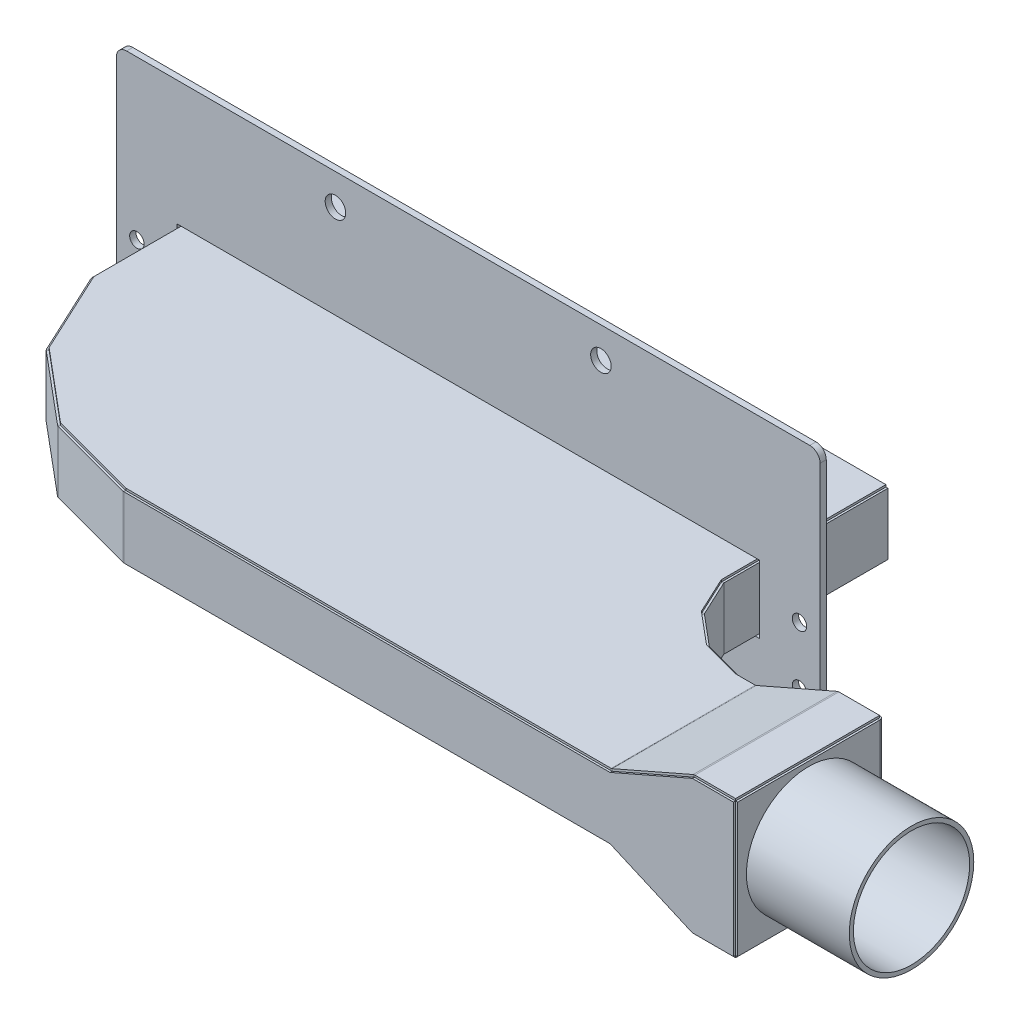
from build123d import *
from build123d.topology import SkipClean

# Parameters (mm, degrees)
BOSS_EXTRUDE1_DEPTH               = 15
BOSS_EXTRUDE2_DEPTH               = 70
CONVERT_SOLID1_START              = -15
CONVERT_SOLID1_DEPTH              = 30
CONVERT_SOLID1_START_2            = 126.158288837
CONVERT_SOLID1_2_DEPTH            = 1
CONVERT_SOLID2_START              = -15
CONVERT_SOLID2_DEPTH              = 30
CONVERT_SOLID2_START_2            = 55.181583873
CONVERT_SOLID2_2_DEPTH            = 1.976704964
CONVERT_SOLID2_START_3            = 56.997604841
CONVERT_SOLID2_3_OUTLINE_W        = 1
CONVERT_SOLID2_3_OUTLINE_H        = 17.5
CONVERT_SOLID2_3_DEPTH            = 69.160683996
CONVERT_SOLID2_START_4            = 55.158288837
CONVERT_SOLID2_4_DEPTH            = 1
CONVERT_SOLID2_START_5            = -33
CONVERT_SOLID2_5_DEPTH            = 66
CONVERT_SOLID3_OUTLINE_W          = 280
CONVERT_SOLID3_OUTLINE_H          = 1
CONVERT_SOLID3_DEPTH              = 44.929534518
CONVERT_SOLID3_START              = 56.158288837
CONVERT_SOLID3_2_DEPTH            = 70
CONVERT_SOLID3_START_2            = 15
CONVERT_SOLID3_3_DEPTH            = 1
CONVERT_SOLID4_OUTLINE_W          = 280
CONVERT_SOLID4_OUTLINE_H          = 1
CONVERT_SOLID4_DEPTH              = 44.929534518
CONVERT_SOLID4_START              = 56.158288837
CONVERT_SOLID4_2_DEPTH            = 70
CONVERT_SOLID4_START_2            = -16
CONVERT_SOLID4_3_DEPTH            = 1
SKETCH13_R                        = 29.5
CUT_EXTRUDE1_DEPTH                = 30
SKETCH14_W                        = 342
SKETCH14_H                        = 76
SKETCH14_W_2                      = 283
SKETCH14_H_2                      = 33
BOSS_EXTRUDE3_DEPTH               = 3
SKETCH16_W                        = 3.5
SKETCH16_H                        = 127.158288837
F_7_0_7_DIAMETER_HOLE2_AT_2_COUNT = 2
F_7_0_7_DIAMETER_HOLE2_AT_2_PITCH = 80.5
F_7_0_7_DIAMETER_HOLE2_AT_3_COUNT = 2
F_7_0_7_DIAMETER_HOLE2_AT_3_PITCH = 80.5
MIRROR1_OUTLINE_R                 = 3.5
MIRROR1_DEPTH                     = 3
SKETCH19_W                        = 3.5
SKETCH19_H                        = 127.158288837
SKETCH20_W                        = 342
SKETCH20_H                        = 39
BOSS_EXTRUDE4_DEPTH               = 3
SKETCH21_W                        = 1
SKETCH21_H                        = 30
BOSS_EXTRUDE5_DEPTH               = 60
SKETCH21_4_W                      = 280
SKETCH21_4_H                      = 1
BOSS_EXTRUDE6_DEPTH               = 60
SKETCH21_5_W                      = 280
SKETCH21_5_H                      = 1
BOSS_EXTRUDE7_DEPTH               = 60
SKETCH21_6_W                      = 1
SKETCH21_6_H                      = 30
BOSS_EXTRUDE8_DEPTH               = 60
SKETCH23_W                        = 5
SKETCH23_H                        = 63
M8_CLEARANCE_HOLE1_AT_2_COUNT     = 2
M8_CLEARANCE_HOLE1_AT_2_PITCH     = 129
SKETCH24_R                        = 30.25
SKETCH24_R_2                      = 28.25
BOSS_EXTRUDE9_DEPTH               = 50
FILLET1_R                         = 5


with BuildPart() as part:
    # Sketch1 → Boss-Extrude1 (new, symmetric)
    with BuildSketch(Plane(origin=(0, 0, 0), x_dir=(1, 0, 0), z_dir=(0, 1, 0))):
        Polygon((-140, 0), (-140, -44.929534518), (-121.011958221, -85.649521519), (-86.593937972, -114.529669616), (-43.195340218, -126.158288837), (193.091770623, -126.158288837), (193.091770623, -56.158288837), (183.091770623, -56.158288837), (163.773254097, -50.981907934), (148.452365235, -38.126155741), (140, -20), (140, 0), align=None)
    extrude(amount=BOSS_EXTRUDE1_DEPTH, both=True)

    # Sketch2 → Boss-Extrude2 (add)
    with BuildSketch(Plane.XY.offset(126.158288837)):
        Polygon((193.091770623, 15), (233.091770623, 32.5), (253.091770623, 32.5), (253.091770623, -32.5), (233.091770623, -32.5), (193.091770623, -15), align=None)
    extrude(amount=-BOSS_EXTRUDE2_DEPTH)


with BuildPart() as body_2:
    # Convert-Solid1: read off the stored shape, not the designer's step
    # Convert-Solid1 outline → Convert-Solid1 (new body)
    with BuildSketch(Plane(origin=(0, 0, 0), x_dir=(1, 0, 0), z_dir=(0, 1, 0)).offset(CONVERT_SOLID1_START)):
        with BuildLine():
            Line((253.091770623, -127.158288837), (253.091770623, -126.158288837))
            Line((253.091770623, -126.158288837), (-43.063687721, -126.158288837))
            ThreePointArc((-43.063687721, -126.158288837), (-43.194213913, -126.149733698), (-43.322506766, -126.124214663))
            Line((-43.322506766, -126.124214663), (-86.379797372, -114.587048417))
            ThreePointArc((-86.379797372, -114.587048417), (-86.582726941, -114.508133424), (-86.763765937, -114.387167033))
            Line((-86.763765937, -114.387167033), (-120.842130257, -85.792024101))
            ThreePointArc((-120.842130257, -85.792024101), (-120.992695988, -85.634741087), (-121.105650434, -85.44859792))
            Line((-121.105650434, -85.44859792), (-139.906307787, -45.130458117))
            ThreePointArc((-139.906307787, -45.130458117), (-139.976296007, -44.924279469), (-140, -44.707839855))
            Line((-140, -44.707839855), (-140, 0))
            Line((-140, 0), (-141, 0))
            Line((-141, 0), (-141, -44.707839855))
            ThreePointArc((-141, -44.707839855), (-140.952592014, -45.140719083), (-140.812615574, -45.553076378))
            Line((-140.812615574, -45.553076378), (-122.011958221, -85.871216182))
            ThreePointArc((-122.011958221, -85.871216182), (-121.786049328, -86.243502516), (-121.484917867, -86.558068544))
            Line((-121.484917867, -86.558068544), (-87.406553546, -115.153211477))
            ThreePointArc((-87.406553546, -115.153211477), (-87.044475553, -115.395144257), (-86.638616417, -115.552974243))
            Line((-86.638616417, -115.552974243), (-43.581325811, -127.090140489))
            ThreePointArc((-43.581325811, -127.090140489), (-43.324740105, -127.141178559), (-43.063687721, -127.158288837))
            Line((-43.063687721, -127.158288837), (253.091770623, -127.158288837))
        make_face()
    extrude(amount=CONVERT_SOLID1_DEPTH)

    # Convert-Solid1 2 outline → Convert-Solid1 2 (add)
    with BuildSketch(Plane.XY.offset(CONVERT_SOLID1_START_2)):
        Polygon((193.091770623, 15), (253.091770623, 15), (253.091770623, 32.5), (233.091770623, 32.5), align=None)
        Polygon((193.091770623, -15), (233.091770623, -32.5), (253.091770623, -32.5), (253.091770623, -15), align=None)
    extrude(amount=CONVERT_SOLID1_2_DEPTH)

    # Sketch21<6> → Boss-Extrude8 (add)
    with BuildSketch(Plane(origin=(0, 0, 0), x_dir=(-1, 0, 0), z_dir=(0, 0, -1))):
        with Locations((140.5, 0)):
            Rectangle(SKETCH21_6_W, SKETCH21_6_H)
    extrude(amount=BOSS_EXTRUDE8_DEPTH)


with BuildPart() as body_3:
    # Convert-Solid2: read off the stored shape, not the designer's step
    # Convert-Solid2 outline → Convert-Solid2 (new body)
    with BuildSketch(Plane(origin=(0, 0, 0), x_dir=(1, 0, 0), z_dir=(0, 1, 0)).offset(CONVERT_SOLID2_START)):
        with BuildLine():
            Line((141, -19.556610675), (141, 0))
            Line((141, 0), (140, 0))
            Line((140, 0), (140, -19.556610675))
            ThreePointArc((140, -19.556610675), (140.047407986, -19.989489903), (140.187384426, -20.401847198))
            Line((140.187384426, -20.401847198), (148.264980809, -37.724308543))
            ThreePointArc((148.264980809, -37.724308543), (148.490889702, -38.096594877), (148.792021164, -38.411160905))
            Line((148.792021164, -38.411160905), (163.433598168, -50.69690277))
            ThreePointArc((163.433598168, -50.69690277), (163.795676161, -50.93883555), (164.201535298, -51.096665536))
            Line((164.201535298, -51.096665536), (182.837437528, -56.090140489))
            ThreePointArc((182.837437528, -56.090140489), (183.094023234, -56.141178559), (183.355075618, -56.158288837))
            Line((183.355075618, -56.158288837), (252.091770623, -56.158288837))
            ThreePointArc((252.091770623, -56.158288837), (252.798877404, -56.451182055), (253.091770623, -57.158288837))
            Line((253.091770623, -57.158288837), (253.091770623, -126.158288837))
            Line((253.091770623, -126.158288837), (254.091770623, -126.158288837))
            Line((254.091770623, -126.158288837), (254.091770623, -57.158288837))
            ThreePointArc((254.091770623, -57.158288837), (253.505984185, -55.744075275), (252.091770623, -55.158288837))
            Line((252.091770623, -55.158288837), (183.355075618, -55.158288837))
            ThreePointArc((183.355075618, -55.158288837), (183.224549426, -55.149733698), (183.096256573, -55.124214663))
            Line((183.096256573, -55.124214663), (164.460354343, -50.13073971))
            ThreePointArc((164.460354343, -50.13073971), (164.257424775, -50.051824717), (164.076385778, -49.930858327))
            Line((164.076385778, -49.930858327), (149.434808773, -37.645116462))
            ThreePointArc((149.434808773, -37.645116462), (149.284243043, -37.487833448), (149.171288596, -37.301690281))
            Line((149.171288596, -37.301690281), (141.093692213, -19.979228936))
            ThreePointArc((141.093692213, -19.979228936), (141.023703993, -19.773050289), (141, -19.556610675))
        make_face()
    extrude(amount=CONVERT_SOLID2_DEPTH)

    # Convert-Solid2 2 outline → Convert-Solid2 2 (add)
    with BuildSketch(Plane.XY.offset(CONVERT_SOLID2_START_2)):
        Polygon((233.091770623, -32.5), (254.091770623, -32.5), (254.091770623, -15), (193.091770623, -15), align=None)
        Polygon((193.091770623, 15), (254.091770623, 15), (254.091770623, 32.5), (233.091770623, 32.5), align=None)
    extrude(amount=CONVERT_SOLID2_2_DEPTH)

    # Convert-Solid2 3 outline → Convert-Solid2 3 (add)
    with BuildSketch(Plane.XY.offset(CONVERT_SOLID2_START_3)):
        with Locations((253.591770623, -23.75)):
            Rectangle(CONVERT_SOLID2_3_OUTLINE_W, CONVERT_SOLID2_3_OUTLINE_H)
        with Locations((253.591770623, 23.75)):
            Rectangle(CONVERT_SOLID2_3_OUTLINE_W, CONVERT_SOLID2_3_OUTLINE_H)
    extrude(amount=CONVERT_SOLID2_3_DEPTH)

    # Convert-Solid2 4 outline → Convert-Solid2 4 (add)
    with BuildSketch(Plane.XY.offset(CONVERT_SOLID2_START_4)):
        Polygon((233.091770623, -32.5), (253.091770623, -32.5), (253.091770623, -15), (193.091770623, -15), align=None)
        Polygon((193.091770623, 15), (253.091770623, 15), (253.091770623, 32.5), (233.091770623, 32.5), align=None)
    extrude(amount=CONVERT_SOLID2_4_DEPTH)

    # Convert-Solid2 5 outline → Convert-Solid2 5 (cut)
    with SkipClean():  # the faces are left unmerged after this step: merging them gives an invalid solid
        with BuildSketch(Plane(origin=(0, 0, 0), x_dir=(1, 0, 0), z_dir=(0, 1, 0)).offset(CONVERT_SOLID2_START_5)):
            with BuildLine():
                Line((253.091770623, -55.181583873), (253.091770623, -55.158288837))
                Line((253.091770623, -55.158288837), (252.091770623, -55.158288837))
                ThreePointArc((252.091770623, -55.158288837), (253.505984185, -55.744075275), (254.091770623, -57.158288837))
                Line((254.091770623, -57.158288837), (254.091770623, -55.181583873))
                Line((254.091770623, -55.181583873), (253.091770623, -55.181583873))
            make_face()
            with BuildLine():
                Line((193.091770623, -57.158288837), (253.091770623, -57.158288837))
                ThreePointArc((253.091770623, -57.158288837), (252.798877404, -56.451182056), (252.091770623, -56.158288837))
                Line((252.091770623, -56.158288837), (193.091770623, -56.158288837))
                Line((193.091770623, -56.158288837), (193.091770623, -57.158288837))
            make_face()
        extrude(amount=CONVERT_SOLID2_5_DEPTH, mode=Mode.SUBTRACT)
    add(body_3.part.scale(1), mode=Mode.REPLACE)  # the faces are merged on a copy

    # Sketch13 → Cut-Extrude1 (cut)
    with BuildSketch(Plane(origin=(254.091770623, 0, 0), x_dir=(0, 0, -1), z_dir=(1, 0, 0))):
        with Locations((-91.658288837, 0)):
            Circle(SKETCH13_R)
    extrude(amount=-CUT_EXTRUDE1_DEPTH, mode=Mode.SUBTRACT)

    # Sketch21 → Boss-Extrude5 (add)
    with BuildSketch(Plane(origin=(0, 0, 0), x_dir=(-1, 0, 0), z_dir=(0, 0, -1))):
        with Locations((-140.5, 0)):
            Rectangle(SKETCH21_W, SKETCH21_H)
    extrude(amount=BOSS_EXTRUDE5_DEPTH)


with BuildPart() as body_4:
    # Convert-Solid3: read off the stored shape, not the designer's step
    # Convert-Solid3 outline → Convert-Solid3 (new body)
    with BuildSketch(Plane.XY):
        with Locations((0, 15.5)):
            Rectangle(CONVERT_SOLID3_OUTLINE_W, CONVERT_SOLID3_OUTLINE_H)
    extrude(amount=CONVERT_SOLID3_DEPTH)

    # Convert-Solid3 2 outline → Convert-Solid3 2 (add)
    with BuildSketch(Plane.XY.offset(CONVERT_SOLID3_START)):
        with BuildLine():
            Line((140, 16), (140, 15))
            Line((140, 15), (192.67341371, 15))
            ThreePointArc((192.67341371, 15), (193.082907703, 15.04237014), (193.475051378, 15.16768533))
            Line((193.475051378, 15.16768533), (232.900130246, 32.416157335))
            ThreePointArc((232.900130246, 32.416157335), (233.096202084, 32.47881493), (233.30094908, 32.5))
            Line((233.30094908, 32.5), (253.091770623, 32.5))
            Line((253.091770623, 32.5), (253.091770623, 33.5))
            Line((253.091770623, 33.5), (233.30094908, 33.5))
            ThreePointArc((233.30094908, 33.5), (232.891455087, 33.45762986), (232.499311412, 33.33231467))
            Line((232.499311412, 33.33231467), (193.074232544, 16.083842665))
            ThreePointArc((193.074232544, 16.083842665), (192.878160706, 16.02118507), (192.67341371, 16))
            Line((192.67341371, 16), (140, 16))
        make_face()
    extrude(amount=CONVERT_SOLID3_2_DEPTH)

    # Convert-Solid3 3 outline → Convert-Solid3 3 (add)
    with BuildSketch(Plane(origin=(0, 0, 0), x_dir=(1, 0, 0), z_dir=(0, 1, 0)).offset(CONVERT_SOLID3_START_2)):
        Polygon((140, -56.158288837), (183.091770623, -56.158288837), (163.773254097, -50.981907934), (148.452365235, -38.126155741), (140, -20), (140, -44.929534518), (-140, -44.929534518), (-121.011958221, -85.649521519), (-86.593937972, -114.529669616), (-43.195340218, -126.158288837), (140, -126.158288837), align=None)
    extrude(amount=CONVERT_SOLID3_3_DEPTH)

    # Sketch21<4> → Boss-Extrude6 (add)
    with BuildSketch(Plane(origin=(0, 0, 0), x_dir=(-1, 0, 0), z_dir=(0, 0, -1))):
        with Locations((0, 15.5)):
            Rectangle(SKETCH21_4_W, SKETCH21_4_H)
    extrude(amount=BOSS_EXTRUDE6_DEPTH)


with BuildPart() as body_5:
    # Convert-Solid4: read off the stored shape, not the designer's step
    # Convert-Solid4 outline → Convert-Solid4 (new body)
    with BuildSketch(Plane.XY):
        with Locations((0, -15.5)):
            Rectangle(CONVERT_SOLID4_OUTLINE_W, CONVERT_SOLID4_OUTLINE_H)
    extrude(amount=CONVERT_SOLID4_DEPTH)

    # Convert-Solid4 2 outline → Convert-Solid4 2 (add)
    with BuildSketch(Plane.XY.offset(CONVERT_SOLID4_START)):
        with BuildLine():
            Line((192.67341371, -15), (140, -15))
            Line((140, -15), (140, -16))
            Line((140, -16), (192.67341371, -16))
            ThreePointArc((192.67341371, -16), (192.878160706, -16.02118507), (193.074232544, -16.083842665))
            Line((193.074232544, -16.083842665), (232.499311412, -33.33231467))
            ThreePointArc((232.499311412, -33.33231467), (232.891455087, -33.45762986), (233.30094908, -33.5))
            Line((233.30094908, -33.5), (253.091770623, -33.5))
            Line((253.091770623, -33.5), (253.091770623, -32.5))
            Line((253.091770623, -32.5), (233.30094908, -32.5))
            ThreePointArc((233.30094908, -32.5), (233.096202084, -32.47881493), (232.900130246, -32.416157335))
            Line((232.900130246, -32.416157335), (193.475051378, -15.16768533))
            ThreePointArc((193.475051378, -15.16768533), (193.082907703, -15.04237014), (192.67341371, -15))
        make_face()
    extrude(amount=CONVERT_SOLID4_2_DEPTH)

    # Convert-Solid4 3 outline → Convert-Solid4 3 (add)
    with BuildSketch(Plane(origin=(0, 0, 0), x_dir=(1, 0, 0), z_dir=(0, 1, 0)).offset(CONVERT_SOLID4_START_2)):
        Polygon((-86.593937972, -114.529669616), (-43.195340218, -126.158288837), (140, -126.158288837), (140, -56.158288837), (183.091770623, -56.158288837), (163.773254097, -50.981907934), (148.452365235, -38.126155741), (140, -20), (140, -44.929534518), (-140, -44.929534518), (-121.011958221, -85.649521519), align=None)
    extrude(amount=CONVERT_SOLID4_3_DEPTH)

    # Sketch21<5> → Boss-Extrude7 (add)
    with BuildSketch(Plane(origin=(0, 0, 0), x_dir=(-1, 0, 0), z_dir=(0, 0, -1))):
        with Locations((0, -15.5)):
            Rectangle(SKETCH21_5_W, SKETCH21_5_H)
    extrude(amount=BOSS_EXTRUDE7_DEPTH)


with BuildPart() as body_6:
    # Sketch14 → Boss-Extrude3 (new body)
    with BuildSketch(Plane.XY):
        Rectangle(SKETCH14_W, SKETCH14_H)
        Rectangle(SKETCH14_W_2, SKETCH14_H_2, mode=Mode.SUBTRACT)
    extrude(amount=BOSS_EXTRUDE3_DEPTH)

    # Sketch16 → Ø7.0 (7) Diameter Hole2 (revolve, cut)
    with BuildSketch(Plane(origin=(80.5, -28, 0), x_dir=(0, 1, 0), z_dir=(1, 0, 0))):
        with Locations((1.75, 63.579144419)):
            Rectangle(SKETCH16_W, SKETCH16_H)
    f_7_0_7_diameter_hole2 = revolve(axis=Axis((80.5, -28, -6.35), (0, 0, 1)), mode=Mode.SUBTRACT)

    # Ø7.0 (7) Diameter Hole2 at 2: Ø7.0 (7) Diameter Hole2 ×2
    with Locations(*[(-i * F_7_0_7_DIAMETER_HOLE2_AT_2_PITCH, 0, 0) for i in range(1, F_7_0_7_DIAMETER_HOLE2_AT_2_COUNT)]):
        add(f_7_0_7_diameter_hole2, mode=Mode.SUBTRACT)

    # Ø7.0 (7) Diameter Hole2 at 3: Ø7.0 (7) Diameter Hole2 ×2
    with Locations(*[(i * F_7_0_7_DIAMETER_HOLE2_AT_3_PITCH, 0, 0) for i in range(1, F_7_0_7_DIAMETER_HOLE2_AT_3_COUNT)]):
        add(f_7_0_7_diameter_hole2, mode=Mode.SUBTRACT)

    # Mirror1: read off the stored shape, not the designer's step
    # Mirror1 outline → Mirror1 (cut)
    with BuildSketch(Plane.XY):
        with Locations((-80.5, -28)):
            Circle(MIRROR1_OUTLINE_R)
        with Locations((-161, -28)):
            Circle(MIRROR1_OUTLINE_R)
    extrude(amount=MIRROR1_DEPTH, mode=Mode.SUBTRACT)

    # Sketch19 → Ø7.0 (7) Diameter Hole1 (revolve, cut)
    with BuildSketch(Plane.YZ.offset(-161)):
        with Locations((1.75, 63.579144419)):
            Rectangle(SKETCH19_W, SKETCH19_H)
    f_7_0_7_diameter_hole1 = revolve(axis=Axis((-161, 0, -6.35), (0, 0, 1)), mode=Mode.SUBTRACT)

    # Mirror2: Ø7.0 (7) Diameter Hole1 across plane
    add(f_7_0_7_diameter_hole1.mirror(Plane(origin=(0, 0, 0), x_dir=(0, 0, 1), z_dir=(1, 0, 0))), mode=Mode.SUBTRACT)

    # Sketch20 → Boss-Extrude4 (add)
    with BuildSketch(Plane.XY.offset(3)):
        with Locations((0, 57.5)):
            Rectangle(SKETCH20_W, SKETCH20_H)
    extrude(amount=-BOSS_EXTRUDE4_DEPTH)

    # Sketch23 → M8 Clearance Hole1 (revolve, cut)
    with BuildSketch(Plane(origin=(-64.5, 62, 3), x_dir=(0, -1, 0), z_dir=(1, 0, 0))):
        with Locations((2.5, 31.5)):
            Rectangle(SKETCH23_W, SKETCH23_H)
    m8_clearance_hole1 = revolve(axis=Axis((-64.5, 62, 9.35), (0, 0, -1)), mode=Mode.SUBTRACT)

    # M8 Clearance Hole1 at 2: M8 Clearance Hole1 ×2
    with Locations(*[(i * M8_CLEARANCE_HOLE1_AT_2_PITCH, 0, 0) for i in range(1, M8_CLEARANCE_HOLE1_AT_2_COUNT)]):
        add(m8_clearance_hole1, mode=Mode.SUBTRACT)

    # Fillet1
    fillet1_edges = [body_6.edges().sort_by_distance(p)[0] for p in [
        (171, 77, 1.5),
        (-171, 77, 1.5),
        (171, -38, 1.5),
        (-171, -38, 1.5),
    ]]
    fillet(fillet1_edges, radius=FILLET1_R)


with BuildPart() as body_7:
    # Sketch24 → Boss-Extrude9 (new body)
    with BuildSketch(Plane(origin=(254.091770623, 0, 0), x_dir=(0, 0, -1), z_dir=(1, 0, 0))):
        with Locations((-91.658288837, 0)):
            Circle(SKETCH24_R)
        with Locations((-91.658288837, 0)):
            Circle(SKETCH24_R_2, mode=Mode.SUBTRACT)
    extrude(amount=BOSS_EXTRUDE9_DEPTH)


solid = Compound([part.part, body_2.part, body_3.part, body_4.part, body_5.part, body_6.part, body_7.part])
